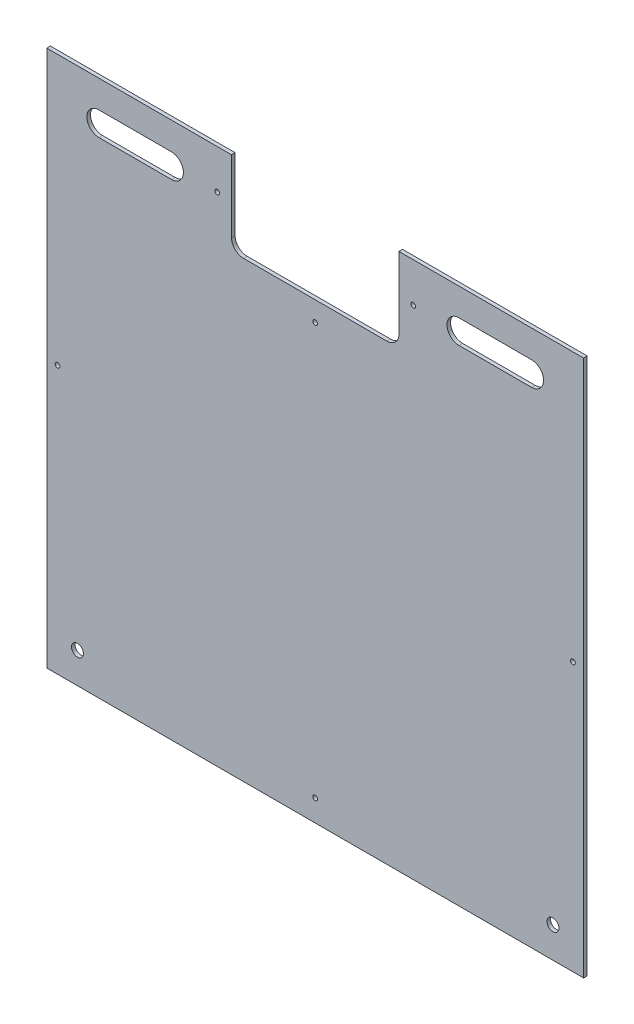
from build123d import *

# Parameters (mm, degrees)
SCHIZZO1_R                   = 2
SCHIZZO1_R_2                 = 5
ESTRUSIONE_ESTRUSIONE1_DEPTH = 3


with BuildPart() as part:
    # Schizzo1 → Estrusione-Estrusione1 (new body)
    with BuildSketch(Plane.XY):
        with BuildLine():
            Line((0, 0), (0, 449))
            Line((0, 449), (154.5, 449))
            Line((154.5, 449), (154.5, 389))
            ThreePointArc((154.5, 389), (157.428932188, 381.928932188), (164.5, 379))
            Line((164.5, 379), (284.5, 379))
            ThreePointArc((284.5, 379), (291.571067812, 381.928932188), (294.5, 389))
            Line((294.5, 389), (294.5, 449))
            Line((294.5, 449), (449, 449))
            Line((449, 449), (449, 0))
            Line((449, 0), (0, 0))
        make_face()
        with Locations((142.566643834, 415.9997554)):
            Circle(SCHIZZO1_R, mode=Mode.SUBTRACT)
        with Locations((224.5, 362.449018035)):
            Circle(SCHIZZO1_R, mode=Mode.SUBTRACT)
        with Locations((306.433356166, 415.9997554)):
            Circle(SCHIZZO1_R, mode=Mode.SUBTRACT)
        with Locations((9, 223.826386399)):
            Circle(SCHIZZO1_R, mode=Mode.SUBTRACT)
        with Locations((440, 224.5)):
            Circle(SCHIZZO1_R, mode=Mode.SUBTRACT)
        with Locations((224.5, 18.146776236)):
            Circle(SCHIZZO1_R, mode=Mode.SUBTRACT)
        with Locations((25.702490096, 25.702490096)):
            Circle(SCHIZZO1_R_2, mode=Mode.SUBTRACT)
        with Locations((423.297509904, 25.702490096)):
            Circle(SCHIZZO1_R_2, mode=Mode.SUBTRACT)
        with BuildLine():
            Line((344.715899345, 425.9997554), (405.440355678, 425.9997554))
            ThreePointArc((405.440355678, 425.9997554), (415.440355678, 415.9997554), (405.440355678, 405.9997554))
            Line((405.440355678, 405.9997554), (344.715899345, 405.9997554))
            ThreePointArc((344.715899345, 405.9997554), (334.715899345, 415.9997554), (344.715899345, 425.9997554))
        make_face(mode=Mode.SUBTRACT)
        with BuildLine():
            Line((104.284100655, 425.9997554), (43.559644322, 425.9997554))
            ThreePointArc((43.559644322, 425.9997554), (33.559644322, 415.9997554), (43.559644322, 405.9997554))
            Line((43.559644322, 405.9997554), (104.284100655, 405.9997554))
            ThreePointArc((104.284100655, 405.9997554), (114.284100655, 415.9997554), (104.284100655, 425.9997554))
        make_face(mode=Mode.SUBTRACT)
    extrude(amount=ESTRUSIONE_ESTRUSIONE1_DEPTH)


solid = part.part
